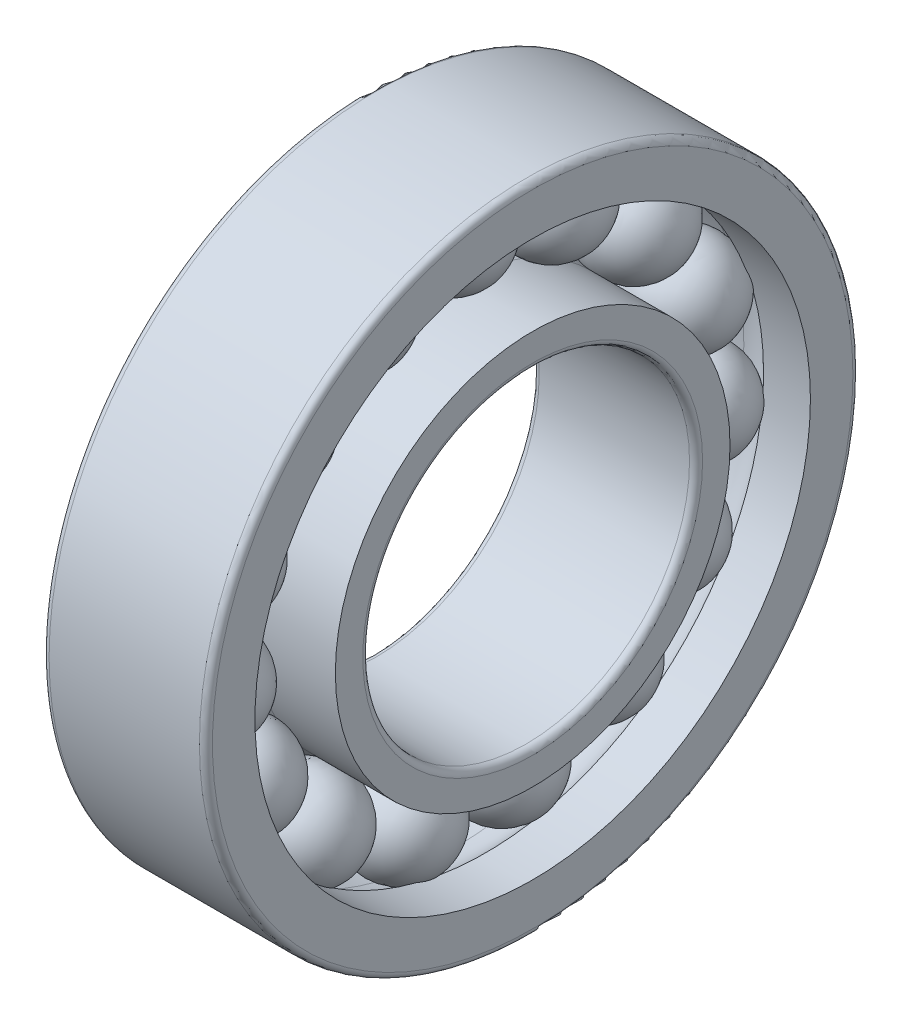
from build123d import *

# Parameters (mm, degrees)
CAGSPISKE_W         = 0.1905
CAGSPISKE_H         = 0.3175
CAGESPINE_ANGLE     = 0.001
BALLSDETAILED_COUNT = 15
BALLSDETAILED_ANGLE = 336


with BuildPart() as part:
    # CagSpiSke → CageSpine (revolve)
    with BuildSketch(Plane.XY):
        with Locations((0, 4.7625)):
            Rectangle(CAGSPISKE_W, CAGSPISKE_H)
    revolve(axis=Axis((-20.6375, 0, 0), (-1, 0, 0)), revolution_arc=CAGESPINE_ANGLE)

    # BalDetSke → BallDetailed (revolve)
    with BuildSketch(Plane.XY):
        with BuildLine():
            Line((-0.9525, 4.7625), (0.9525, 4.7625))
            ThreePointArc((0.9525, 4.7625), (0, 3.81), (-0.9525, 4.7625))
        make_face()
    balldetailed = revolve(axis=Axis((-1.905, 4.7625, 0), (1, 0, 0)))

    # InnRacSke → InnerRace (revolve)
    with BuildSketch(Plane.XY):
        with BuildLine():
            Line((-0.676040864, 4.1275), (-1.5875, 4.1275))
            Line((-1.5875, 4.1275), (-1.5875, 3.302))
            ThreePointArc((-1.5875, 3.302), (-1.550302561, 3.212197439), (-1.4605, 3.175))
            Line((-1.4605, 3.175), (1.4605, 3.175))
            ThreePointArc((1.4605, 3.175), (1.550302561, 3.212197439), (1.5875, 3.302))
            Line((1.5875, 3.302), (1.5875, 3.835))
            Line((1.5875, 3.835), (0, 3.835))
            ThreePointArc((0, 3.835), (-0.368302695, 3.911260096), (-0.676040864, 4.1275))
        make_face()
    revolve(axis=Axis((-20.6375, 0, 0), (1, 0, 0)))

    # OutRacSke → OuterRace (revolve)
    with BuildSketch(Plane.XY):
        with BuildLine():
            Line((0, 5.69), (-1.5875, 5.69))
            Line((-1.5875, 5.69), (-1.5875, 6.223))
            ThreePointArc((-1.5875, 6.223), (-1.550302561, 6.312802561), (-1.4605, 6.35))
            Line((-1.4605, 6.35), (1.4605, 6.35))
            ThreePointArc((1.4605, 6.35), (1.550302561, 6.312802561), (1.5875, 6.223))
            Line((1.5875, 6.223), (1.5875, 5.3975))
            Line((1.5875, 5.3975), (0.676040864, 5.3975))
            ThreePointArc((0.676040864, 5.3975), (0.368302695, 5.613739904), (0, 5.69))
        make_face()
    revolve(axis=Axis((-20.6375, 0, 0), (1, 0, 0)))

    # BallsDetailed: BallDetailed ×15 about axis
    ballsdetailed_axis = Axis((-50, 0, 0), (1, 0, 0))
    for i in range(1, BALLSDETAILED_COUNT):
        add(balldetailed.rotate(ballsdetailed_axis, i * BALLSDETAILED_ANGLE / (BALLSDETAILED_COUNT - 1)))


solid = part.part
